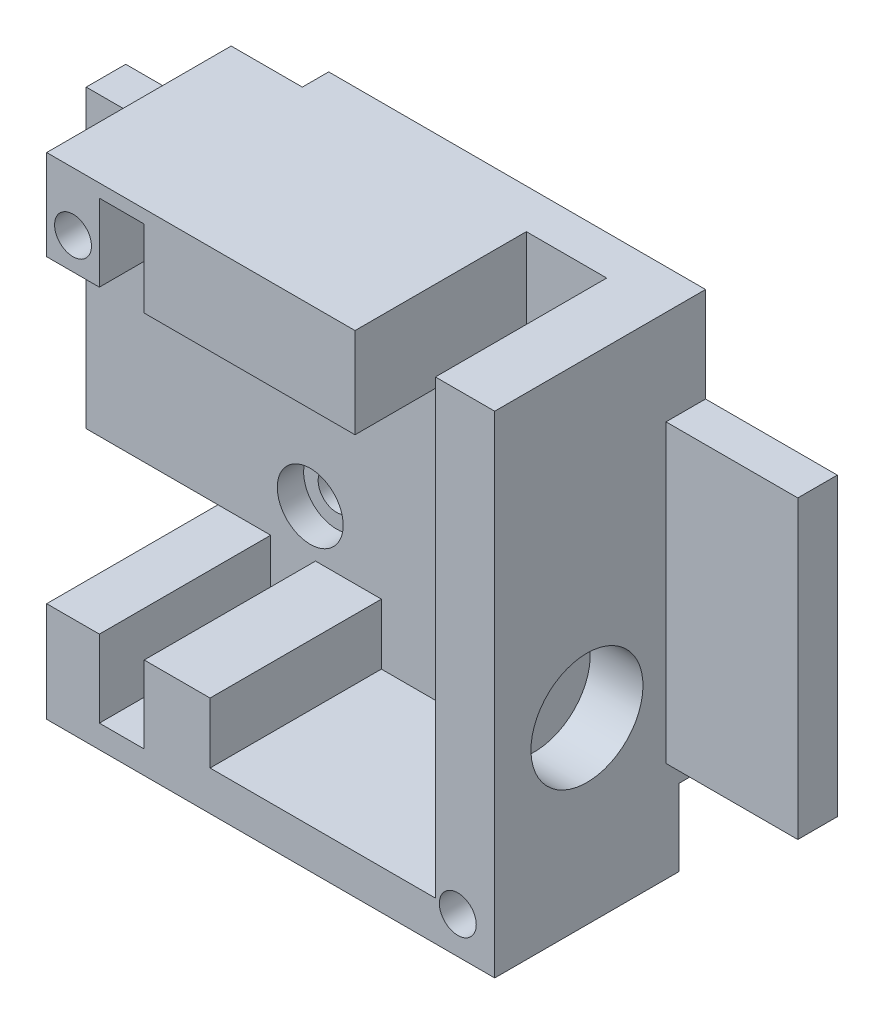
from build123d import *

# Parameters (mm, degrees)
SKETCH1_W                = 34
SKETCH1_H                = 38
BOSS_EXTRUDE1_DEPTH      = 16
SKETCH2_W                = 22.4
SKETCH2_H                = 22.8
SKETCH2_W_2              = 2.4
SKETCH2_H_2              = 4.85
CUT_EXTRUDE1_DEPTH       = 13
CUT_EXTRUDE2_DEPTH       = 13
SKETCH4_R                = 1.4
CUT_EXTRUDE3_DEPTH       = 31.099833887
CUT_EXTRUDE5_START       = -2
SKETCH5_R                = 1.4
CUT_EXTRUDE5_DEPTH       = 2
SKETCH7_W                = 34
SKETCH7_H                = 1
CUT_EXTRUDE6_DEPTH       = 45.598206242
CUT_EXTRUDE9_DEPTH       = 30.580398915
CUT_EXTRUDE10_DEPTH      = 29.178005607
CUT_EXTRUDE10_DEPTH_BACK = 2
SKETCH10_R               = 2.5
SKETCH11_W               = 5
SKETCH11_H               = 4.5
CUT_EXTRUDE11_DEPTH      = 12
SKETCH12_W               = 1
SKETCH12_H               = 4.85
SKETCH12_H_2             = 22.8
CUT_EXTRUDE12_DEPTH      = 12
SKETCH14_R               = 4.25
CUT_EXTRUDE13_DEPTH      = 4
SKETCH17_W               = 3.4
SKETCH17_H               = 1
CUT_EXTRUDE16_DEPTH      = 12
SKETCH18_R               = 1.4
CUT_EXTRUDE17_DEPTH      = 12
BOSS_EXTRUDE2_DEPTH      = 16
BOSS_EXTRUDE3_START      = 1
SKETCH20_R               = 1.4
BOSS_EXTRUDE3_DEPTH      = 1
SKETCH21_W               = 6.1
SKETCH21_H               = 23.876697272
CUT_EXTRUDE18_DEPTH      = 13
BOSS_EXTRUDE4_DEPTH      = 10
SKETCH23_W               = 6.1
SKETCH23_H               = 6.85
CUT_EXTRUDE19_DEPTH      = 13


with BuildPart() as part:
    # Sketch1 → Boss-Extrude1 (new body)
    with BuildSketch(Plane.XY):
        Rectangle(SKETCH1_W, SKETCH1_H)
    extrude(amount=BOSS_EXTRUDE1_DEPTH)

    # Sketch2 → Cut-Extrude1 (cut)
    with BuildSketch(Plane.XY.offset(16)):
        with Locations((-5.8, 0)):
            Rectangle(SKETCH2_W, SKETCH2_H)
        with Locations((-11.8, -13.825)):
            Rectangle(SKETCH2_W_2, SKETCH2_H_2)
        with Locations((-11.8, 13.825)):
            Rectangle(SKETCH2_W_2, SKETCH2_H_2)
    extrude(amount=-CUT_EXTRUDE1_DEPTH, mode=Mode.SUBTRACT)

    # Sketch3 → Cut-Extrude2 (cut)
    with BuildSketch(Plane.XY.offset(16)):
        Polygon((-4.6, -16), (11.4, -16), (11.4, 19), (8.4, 19), (8.4, -11.4), (-4.6, -11.4), align=None)
    extrude(amount=-CUT_EXTRUDE2_DEPTH, mode=Mode.SUBTRACT)

    # Sketch4 → Cut-Extrude3 (cut, through all)
    with BuildSketch(Plane.XY.offset(16)):
        with Locations((-15, 13.8)):
            Circle(SKETCH4_R)
        with Locations((14.2, -16.2)):
            Circle(SKETCH4_R)
    extrude(amount=-CUT_EXTRUDE3_DEPTH, mode=Mode.SUBTRACT)

    # Sketch5 → Cut-Extrude5 (cut)
    # profile 1 of 2: a face of its own
    with BuildSketch(Plane(origin=(0, 0, 0), x_dir=(-1, 0, 0), z_dir=(0, 0, -1)).offset(CUT_EXTRUDE5_START)):
        with BuildLine():
            Line((18.4, 13.8), (18.4, 19))
            Line((18.4, 19), (11.6, 19))
            Line((11.6, 19), (11.6, 13.8))
            ThreePointArc((11.6, 13.8), (15, 10.4), (18.4, 13.8))
        make_face()
        with Locations((15, 13.8)):
            Circle(SKETCH5_R, mode=Mode.SUBTRACT)
    # profile 2 of 2: a face of its own
    with BuildSketch(Plane(origin=(0, 0, 0), x_dir=(-1, 0, 0), z_dir=(0, 0, -1)).offset(CUT_EXTRUDE5_START)):
        with BuildLine():
            Line((-13.122967039, -19), (-10.2, -19))
            Line((-10.2, -19), (-10.2, -13.2))
            Line((-10.2, -13.2), (-17, -13.2))
            Line((-17, -13.2), (-17, -15.122967039))
            ThreePointArc((-17, -15.122967039), (-17.2, -16.2), (-17, -17.277032961))
            Line((-17, -17.277032961), (-17, -19.2))
            Line((-17, -19.2), (-14.2, -19.2))
            ThreePointArc((-14.2, -19.2), (-13.652277442, -19.149576241), (-13.122967039, -19))
        make_face()
        with Locations((-14.2, -16.2)):
            Circle(SKETCH5_R, mode=Mode.SUBTRACT)
    extrude(amount=CUT_EXTRUDE5_DEPTH, mode=Mode.SUBTRACT)

    # Sketch7 → Cut-Extrude6 (cut, through all)
    with BuildSketch(Plane(origin=(0, 19, 0), x_dir=(1, 0, 0), z_dir=(0, 1, 0))):
        with Locations((0, -15.5)):
            Rectangle(SKETCH7_W, SKETCH7_H)
    extrude(amount=-CUT_EXTRUDE6_DEPTH, mode=Mode.SUBTRACT)

    # Sketch9 → Cut-Extrude9 (cut, through all)
    with BuildSketch(Plane.XY.offset(15)):
        Polygon((-17, 19), (-17, 18.25), (-9, 18.25), (-9, 12.5), (13.4, 12.5), (13.4, 1), (17, 1), (17, 19), align=None)
        Polygon((-14, -12.4), (-17, -12.4), (-17, -19), (11.4, -19), (11.4, -17), (-5.6, -17), (-5.6, -12.4), (-8.6, -12.4), (-8.6, -18.25), (-14, -18.25), align=None)
    extrude(amount=-CUT_EXTRUDE9_DEPTH, mode=Mode.SUBTRACT)

    # Sketch10 → Cut-Extrude10 (cut, two sides: drawn at the far end of the back side and taken through both)
    with BuildSketch(Plane.XY.offset(3).offset(-CUT_EXTRUDE10_DEPTH_BACK)):
        with Locations((-10, 8)):
            Circle(SKETCH10_R)
        with Locations((10, 8)):
            Circle(SKETCH10_R)
        with Locations((-10, -8)):
            Circle(SKETCH10_R)
        with Locations((10, -8)):
            Circle(SKETCH10_R)
    extrude(amount=CUT_EXTRUDE10_DEPTH + CUT_EXTRUDE10_DEPTH_BACK, mode=Mode.SUBTRACT)

    # Sketch11 → Cut-Extrude11 (cut)
    with BuildSketch(Plane.XY.offset(15)):
        Polygon((12.5, -8), (7.5, -8), (7.5, -11.4), (11.4, -11.4), (11.4, -16), (12.5, -16), (12.5, -11.4), align=None)
        with Locations((10, 10.25)):
            Rectangle(SKETCH11_W, SKETCH11_H)
    extrude(amount=-CUT_EXTRUDE11_DEPTH, mode=Mode.SUBTRACT)

    # Sketch12 → Cut-Extrude12 (cut)
    with BuildSketch(Plane.XY.offset(15)):
        with Locations((-10.1, 13.825)):
            Rectangle(SKETCH12_W, SKETCH12_H)
        with Locations((-10.1, -13.825)):
            Rectangle(SKETCH12_W, SKETCH12_H)
        with Locations((5.9, 0)):
            Rectangle(SKETCH12_W, SKETCH12_H_2)
    extrude(amount=-CUT_EXTRUDE12_DEPTH, mode=Mode.SUBTRACT)

    # Sketch14 → Cut-Extrude13 (cut)
    with BuildSketch(Plane(origin=(17, 0, 0), x_dir=(0, 0, -1), z_dir=(1, 0, 0))):
        with Locations((-9, -5.4)):
            Circle(SKETCH14_R)
    extrude(amount=-CUT_EXTRUDE13_DEPTH, mode=Mode.SUBTRACT)

    # Sketch17 → Cut-Extrude16 (cut)
    with BuildSketch(Plane.XY.offset(15)):
        with Locations((-11.3, 16.75)):
            Rectangle(SKETCH17_W, SKETCH17_H)
        with Locations((-11.3, -16.75)):
            Rectangle(SKETCH17_W, SKETCH17_H)
    extrude(amount=-CUT_EXTRUDE16_DEPTH, mode=Mode.SUBTRACT)

    # Sketch18 → Cut-Extrude17 (cut)
    with BuildSketch(Plane.XY.offset(1)):
        with Locations((-10, 8)):
            Circle(SKETCH18_R)
        with Locations((10, 8)):
            Circle(SKETCH18_R)
        with Locations((-10, -8)):
            Circle(SKETCH18_R)
        with Locations((10, -8)):
            Circle(SKETCH18_R)
    extrude(amount=-CUT_EXTRUDE17_DEPTH, mode=Mode.SUBTRACT)

    # Sketch19 → Boss-Extrude2 (add)
    with BuildSketch(Plane.XY):
        Polygon((17, 18.25), (-9, 18.25), (-9, 12.476697272), (13.4, 12.476697272), (13.4, 1), (17, 1), align=None)
        Polygon((-14, -12.4), (-17, -12.4), (-17, -19), (11.4, -19), (11.4, -17), (-5.6, -17), (-5.6, -12.4), (-8.6, -12.4), (-8.6, -18.25), (-14, -18.25), align=None)
    extrude(amount=BOSS_EXTRUDE2_DEPTH)

    # Sketch20 → Boss-Extrude3 (add)
    # profile 1 of 2: a face of its own
    with BuildSketch(Plane.XY.offset(15).offset(BOSS_EXTRUDE3_START)):
        Polygon((-17, 18.25), (-17, 11.4), (-13, 11.4), (-13, 17.25), (-9.6, 17.25), (-9.6, 11.4), (6.4, 11.4), (6.4, -11.4), (7.5, -11.4), (7.5, 12.476697272), (-9, 12.476697272), (-9, 18.25), align=None)
        with Locations((-15, 13.8)):
            Circle(SKETCH20_R, mode=Mode.SUBTRACT)
    # profile 2 of 2: a face of its own
    with BuildSketch(Plane.XY.offset(15).offset(BOSS_EXTRUDE3_START)):
        Polygon((-13, -11.4), (-17, -11.4), (-17, -12.4), (-14, -12.4), (-14, -18.25), (-8.6, -18.25), (-8.6, -12.4), (-5.6, -12.4), (-5.6, -17), (11.4, -17), (11.4, -19), (17, -19), (17, 1), (13.4, 1), (13.4, 12.476697272), (12.5, 12.476697272), (12.5, -16), (-4.6, -16), (-4.6, -11.4), (-9.6, -11.4), (-9.6, -17.25), (-13, -17.25), align=None)
        with Locations((14.2, -16.2)):
            Circle(SKETCH20_R, mode=Mode.SUBTRACT)
    extrude(amount=-BOSS_EXTRUDE3_DEPTH)

    # Sketch21 → Cut-Extrude18 (cut)
    with BuildSketch(Plane.XY.offset(16)):
        with Locations((9.45, 0.538348636)):
            Rectangle(SKETCH21_W, SKETCH21_H)
    extrude(amount=-CUT_EXTRUDE18_DEPTH, mode=Mode.SUBTRACT)

    # Sketch22 → Boss-Extrude4 (add)
    with BuildSketch(Plane.ZY.offset(17)):
        Polygon((2, 11.050454583), (0, 11.050454583), (0, -11.4), (3, -11.4), (3, 11.050454583), align=None)
    boss_extrude4 = extrude(amount=BOSS_EXTRUDE4_DEPTH)

    # Mirror1: Boss-Extrude4 across plane
    add(boss_extrude4.mirror(Plane(origin=(0, 0, 0), x_dir=(0, 0, 1), z_dir=(1, 0, 0))))

    # Sketch23 → Cut-Extrude19 (cut)
    with BuildSketch(Plane.XY.offset(16)):
        with Locations((9.45, 14.825)):
            Rectangle(SKETCH23_W, SKETCH23_H)
    extrude(amount=-CUT_EXTRUDE19_DEPTH, mode=Mode.SUBTRACT)


solid = part.part
